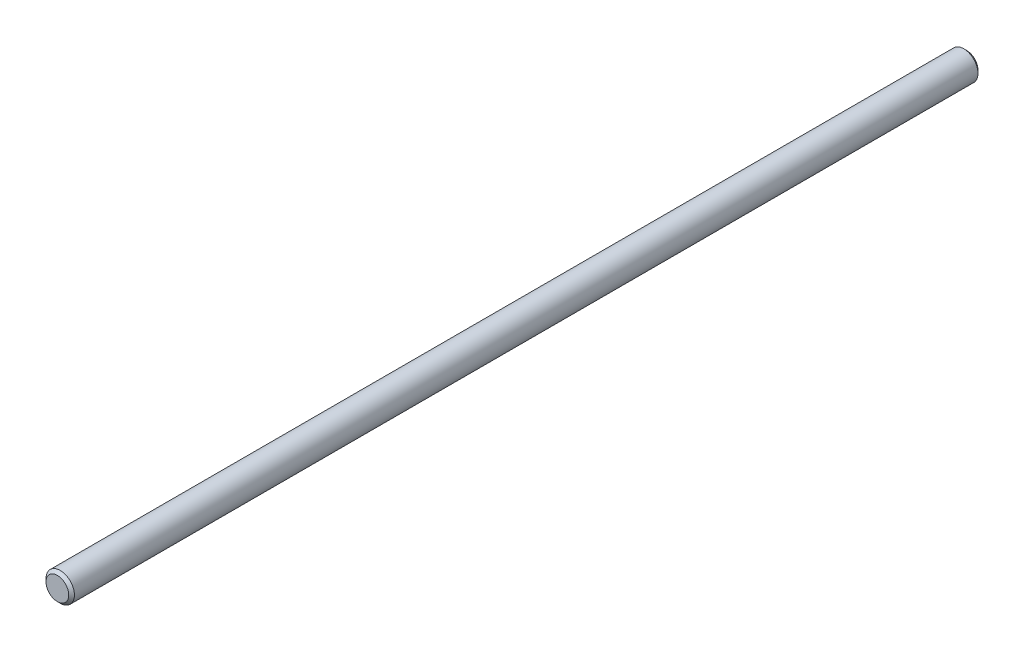
from build123d import *

# Parameters (mm, degrees)
SKETCH1_R      = 4.7625
EXTRUDE1_DEPTH = 152.4
CHAMFER1_SIZE  = 0.9525


with BuildPart() as part:
    # Sketch1 → Extrude1 (new, symmetric)
    with BuildSketch(Plane.XY):
        Circle(SKETCH1_R)
    extrude(amount=EXTRUDE1_DEPTH, both=True)

    # Chamfer1
    chamfer1_edges = [part.edges().sort_by_distance(p)[0] for p in [
        (-4.7625, 0, -152.4),
        (-4.7625, 0, 152.4),
    ]]
    chamfer(chamfer1_edges, length=CHAMFER1_SIZE)


solid = part.part
